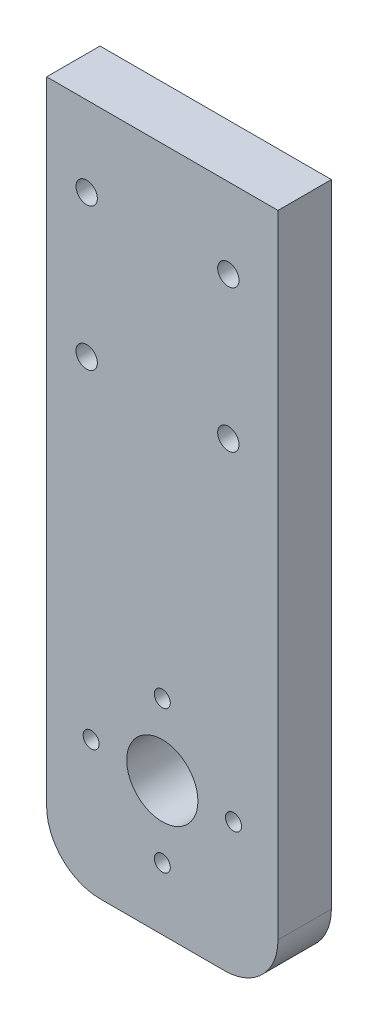
from build123d import *

# Parameters (mm, degrees)
ESQUISSE1_R             = 0.9
ESQUISSE1_R_2           = 4
BOSS_EXTRU_1_DEPTH      = 6
ESQUISSE2_R             = 1.2
ENL_V_MAT_EXTRU_1_DEPTH = 10


with BuildPart() as part:
    # Esquisse1 → Boss.-Extru.1 (new body)
    with BuildSketch(Plane.XY):
        with BuildLine():
            Line((24.916434397, -77.573457495), (24.916434397, -6.573457495))
            Line((24.916434397, -6.573457495), (50.916434397, -6.573457495))
            Line((50.916434397, -6.573457495), (50.916434397, -77.573457495))
            ThreePointArc((50.916434397, -77.573457495), (49.159075085, -81.816098182), (44.916434397, -83.573457495))
            Line((44.916434397, -83.573457495), (30.916434397, -83.573457495))
            ThreePointArc((30.916434397, -83.573457495), (26.67379371, -81.816098182), (24.916434397, -77.573457495))
        make_face()
        with Locations((29.916434397, -68.573457495)):
            Circle(ESQUISSE1_R, mode=Mode.SUBTRACT)
        with Locations((37.916434397, -60.573457495)):
            Circle(ESQUISSE1_R, mode=Mode.SUBTRACT)
        with Locations((45.916434397, -68.573457495)):
            Circle(ESQUISSE1_R, mode=Mode.SUBTRACT)
        with Locations((37.916434397, -76.573457495)):
            Circle(ESQUISSE1_R, mode=Mode.SUBTRACT)
        with Locations((37.916434397, -68.573457495)):
            Circle(ESQUISSE1_R_2, mode=Mode.SUBTRACT)
    extrude(amount=BOSS_EXTRU_1_DEPTH)

    # Esquisse2 → Enlèv. mat.-Extru.1 (cut)
    with BuildSketch(Plane(origin=(0, 0, 0), x_dir=(-1, 0, 0), z_dir=(0, 0, -1))):
        with Locations((-45.336434397, -15.573457495)):
            Circle(ESQUISSE2_R)
        with Locations((-29.416434397, -15.573457495)):
            Circle(ESQUISSE2_R)
        with Locations((-45.336434397, -31.573457495)):
            Circle(ESQUISSE2_R)
        with Locations((-29.416434397, -31.573457495)):
            Circle(ESQUISSE2_R)
    extrude(amount=-ENL_V_MAT_EXTRU_1_DEPTH, mode=Mode.SUBTRACT)


solid = part.part
